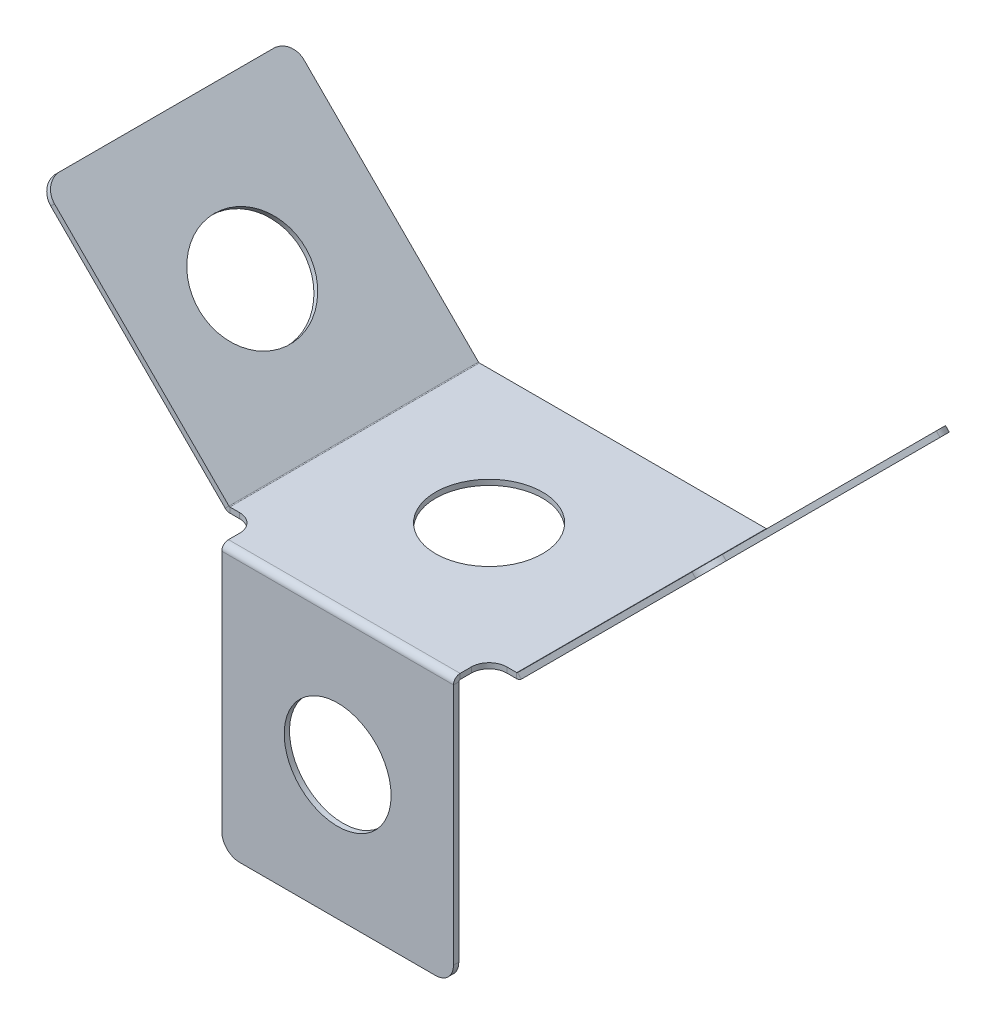
from build123d import *

# Parameters (mm, degrees)
SKETCH1_R          = 30
BASE_FLANGE1_DEPTH = 3
EDGE_FLANGE1_START = -75
EDGE_FLANGE1_DEPTH = 140
EDGE_FLANGE2_START = -75
EDGE_FLANGE2_DEPTH = 140
EDGE_FLANGE3_DEPTH = 130
SKETCH23_R         = 30
CUT_EXTRUDE1_DEPTH = 10
SKETCH24_R         = 30
CUT_EXTRUDE2_DEPTH = 10
FILLET1_R          = 10


# Read off the part's stored shape, not the designer's step: Edge-Flange1, Edge-Flange2
# Sheet-metal steps are written as plain solids
with BuildPart() as part:
    # Sketch1 → Base-Flange1 (new body)
    with BuildSketch(Plane(origin=(0, 0, 0), x_dir=(1, 0, 0), z_dir=(0, 1, 0))):
        with BuildLine():
            Line((65, -75), (-65, -75))
            ThreePointArc((-65, -75), (-67.928932188, -67.928932188), (-75, -65))
            Line((-75, -65), (-75, 75))
            Line((-75, 75), (75, 75))
            Line((75, 75), (75, -65))
            ThreePointArc((75, -65), (67.928932188, -67.928932188), (65, -75))
        make_face()
        with Locations(Location((0, 0, 0), (0, 0, 270))):
            Circle(SKETCH1_R, mode=Mode.SUBTRACT)
    extrude(amount=-BASE_FLANGE1_DEPTH)

    # Edge-Flange1 outline → Edge-Flange1 (add)
    with BuildSketch(Plane.XY.offset(EDGE_FLANGE1_START)):
        with BuildLine():
            Line((-188.066017178, 103.066017178), (-83.094424801, -1.905575199))
            ThreePointArc((-83.094424801, -1.905575199), (-81.882184516, -2.715568261), (-80.452249603, -3))
            Line((-80.452249603, -3), (-75, -3))
            Line((-75, -3), (-75, 0))
            Line((-75, 0), (-80.452249603, 0))
            ThreePointArc((-80.452249603, 0), (-80.734134219, 0.056070336), (-80.973104458, 0.215745145))
            Line((-80.973104458, 0.215745145), (-185.944696834, 105.187337522))
            Line((-185.944696834, 105.187337522), (-188.066017178, 103.066017178))
        make_face()
    extrude(amount=EDGE_FLANGE1_DEPTH)

    # Edge-Flange2 outline → Edge-Flange2 (add)
    with BuildSketch(Plane.XY.offset(EDGE_FLANGE2_START)):
        with BuildLine():
            ThreePointArc((80.452249603, -3), (81.882184516, -2.715568261), (83.094424801, -1.905575199))
            Line((83.094424801, -1.905575199), (188.066017178, 103.066017178))
            Line((188.066017178, 103.066017178), (185.944696834, 105.187337522))
            Line((185.944696834, 105.187337522), (80.973104458, 0.215745145))
            ThreePointArc((80.973104458, 0.215745145), (80.734134219, 0.056070336), (80.452249603, 0))
            Line((80.452249603, 0), (75, 0))
            Line((75, 0), (75, -3))
            Line((75, -3), (80.452249603, -3))
        make_face()
    extrude(amount=EDGE_FLANGE2_DEPTH)

    # Edge-Flange3 section (across the edge) → Edge-Flange3 (add)
    with BuildSketch(Plane(origin=(65, -3, 85), x_dir=(0, 0, -1), z_dir=(-1, 0, 0))):
        with BuildLine():
            Line((0, 0.7366), (0, 147))
            Line((0, 147), (3, 147))
            Line((3, 147), (3, 0.7366))
            ThreePointArc((3, 0.7366), (3.215745145, 0.215745145), (3.7366, 0))
            Line((3.7366, 0), (10, 0))
            Line((10, 0), (10, -3))
            Line((10, -3), (3.7366, -3))
            ThreePointArc((3.7366, -3), (1.094424801, -1.905575199), (0, 0.7366))
        make_face()
    extrude(amount=EDGE_FLANGE3_DEPTH)

    # Sketch23 → Cut-Extrude1 (cut)
    with BuildSketch(Plane(origin=(-40.378679656, -40.378679656, 0), x_dir=(0, 0, -1), z_dir=(0.7071067811865438, 0.7071067811865513, 0))):
        with Locations(Location((0, 130.861435714, 0), (0, 0, 90))):
            Circle(SKETCH23_R)
    cut_extrude1 = extrude(amount=-CUT_EXTRUDE1_DEPTH, mode=Mode.SUBTRACT)

    # Mirror1: Cut-Extrude1 across plane
    add(cut_extrude1.mirror(Plane(origin=(0, 0, 0), x_dir=(0, 0, 1), z_dir=(1, 0, 0))), mode=Mode.SUBTRACT)

    # Sketch24 → Cut-Extrude2 (cut)
    with BuildSketch(Plane.XY.offset(85)):
        with Locations((0, -75)):
            Circle(SKETCH24_R)
    extrude(amount=-CUT_EXTRUDE2_DEPTH, mode=Mode.SUBTRACT)

    # Fillet1
    fillet1_edges = [part.edges().sort_by_distance(p)[0] for p in [
        (-187.005357006, 104.12667735, -75),
        (-187.005357006, 104.12667735, 65),
        (187.005357006, 104.12667735, 65),
        (187.005357006, 104.12667735, -75),
        (65, -150, 83.5),
        (-65, -150, 83.5),
    ]]
    fillet(fillet1_edges, radius=FILLET1_R)


solid = part.part
